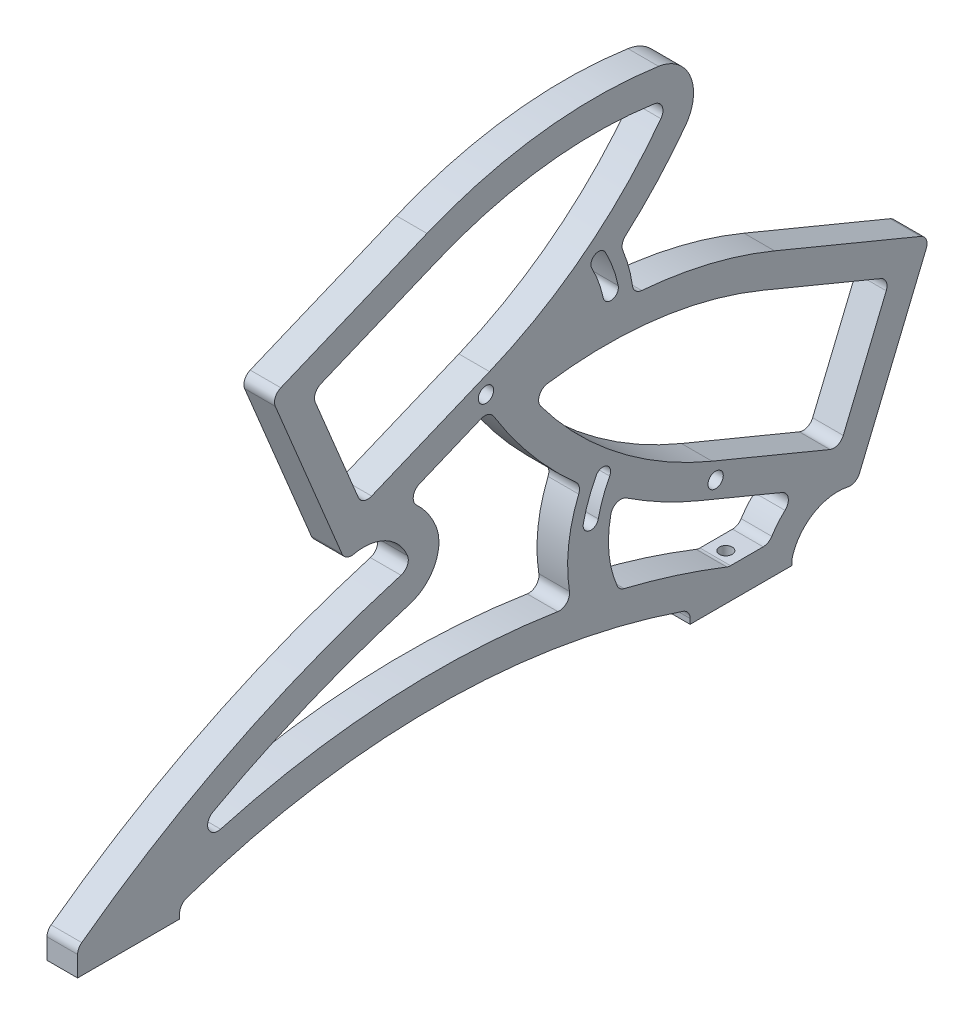
from build123d import *

# Parameters (mm, degrees)
SKETCH1_R                   = 1.5
BOSS_EXTRUDE1_DEPTH         = 6
FILLET1_R                   = 2
TAP_DRILL_FOR_M3_TAP1_D     = 2.5
TAP_DRILL_FOR_M3_TAP1_DEPTH = 10
TAP_DRILL_FOR_M3_TAP1_TIP   = 0.751075774


with BuildPart() as part:
    # Sketch1 → Boss-Extrude1 (new body)
    with BuildSketch(Plane(origin=(0, 0, 0), x_dir=(0, 0, -1), z_dir=(1, 0, 0))):
        with BuildLine():
            Line((0, 0), (0, 5))
            ThreePointArc((0, 5), (30.263904534, 23.654794569), (63.35257649, 36.656527771))
            ThreePointArc((63.35257649, 36.656527771), (64.593543685, 37.712278476), (64.63724154, 39.340989509))
            ThreePointArc((64.63724154, 39.340989509), (59.61305605, 44.365174999), (52.507784789, 44.365174999))
            Line((52.507784789, 44.365174999), (37.965814359, 79.472597235))
            Line((37.965814359, 79.472597235), (68.453838932, 92.101150503))
            ThreePointArc((68.453838932, 92.101150503), (90.758303247, 97.999189725), (113.828291361, 97.771937753))
            ThreePointArc((113.828291361, 97.771937753), (120.071041294, 92.916243967), (119.090244487, 85.068459153))
            ThreePointArc((119.090244487, 85.068459153), (113.049914098, 77.838922298), (106.256946475, 71.311489017))
            ThreePointArc((106.256946475, 71.311489017), (108.007602478, 66.521582509), (108.89212085, 61.499070385))
            ThreePointArc((108.89212085, 61.499070385), (122.984208709, 59.44582567), (136.546161068, 55.101150503))
            Line((136.546161068, 55.101150503), (167.034185641, 42.472597235))
            Line((167.034185641, 42.472597235), (152.492215211, 7.365174999))
            ThreePointArc((152.492215211, 7.365174999), (145.029217261, 7.208101321), (140.094434117, 1.607304426))
            ThreePointArc((140.094434117, 1.607304426), (140.023749539, 1.307301346), (140, 1))
            Line((140, 1), (140, 0))
            Line((140, 0), (120, 0))
            Line((120, 0), (120, 1))
            ThreePointArc((120, 1), (119.627466942, 2.162476387), (118.648648649, 2.891891892))
            ThreePointArc((118.648648649, 2.891891892), (70, 11), (21.351351351, 2.891891892))
            ThreePointArc((21.351351351, 2.891891892), (20.372533058, 2.162476387), (20, 1))
            Line((20, 1), (20, 0))
            Line((20, 0), (0, 0))
        make_face()
        with Locations((80, 59)):
            Circle(SKETCH1_R, mode=Mode.SUBTRACT)
        with Locations((125, 22)):
            Circle(SKETCH1_R, mode=Mode.SUBTRACT)
        with BuildLine():
            Line((63.72452745, 49.011301935), (80.634345003, 56.015577702))
            ThreePointArc((80.634345003, 56.015577702), (88.793282839, 44.416446703), (98.743053525, 34.311489017))
            ThreePointArc((98.743053525, 34.311489017), (96.120508219, 24.64101391), (96.9455023, 14.655263189))
            ThreePointArc((96.9455023, 14.655263189), (53.225179751, 16.095471906), (10.823862094, 5.340516497))
            ThreePointArc((10.823862094, 5.340516497), (36.939787477, 20.226495708), (65.041858534, 30.899243153))
            ThreePointArc((65.041858534, 30.899243153), (70.005727314, 35.122245973), (70.180518735, 41.637090103))
            ThreePointArc((70.180518735, 41.637090103), (67.559666076, 45.855738901), (63.72452745, 49.011301935))
        make_face(mode=Mode.SUBTRACT)
        with BuildLine():
            Line((80.699708768, 62.537005462), (55.75496139, 52.204552788))
            Line((55.75496139, 52.204552788), (45.805192149, 76.225420634))
            Line((45.805192149, 76.225420634), (70.749939526, 86.557873308))
            ThreePointArc((70.749939526, 86.557873308), (91.502380524, 92.045506075), (112.967077451, 91.834066872))
            ThreePointArc((112.967077451, 91.834066872), (114.527764673, 90.620143611), (114.282565525, 88.658197723))
            ThreePointArc((114.282565525, 88.658197723), (99.254242865, 73.330854875), (80.699708768, 62.537005462))
        make_face(mode=Mode.SUBTRACT)
        with BuildLine():
            Line((124.300291232, 25.537005462), (149.24503861, 15.204552788))
            Line((149.24503861, 15.204552788), (159.194807851, 39.225420634))
            Line((159.194807851, 39.225420634), (134.250060474, 49.557873308))
            ThreePointArc((134.250060474, 49.557873308), (113.497619632, 55.045506055), (92.032922859, 54.834066917))
            ThreePointArc((92.032922859, 54.834066917), (90.472235487, 53.620143544), (90.717434663, 51.658197472))
            ThreePointArc((90.717434663, 51.658197472), (105.745757258, 36.330854779), (124.300291232, 25.537005462))
        make_face(mode=Mode.SUBTRACT)
        with BuildLine():
            Line((122.004190638, 19.993728267), (141.27547255, 12.011301935))
            ThreePointArc((141.27547255, 12.011301935), (137.950950961, 9.410732752), (135.464526627, 6))
            Line((135.464526627, 6), (127.541289523, 6))
            ThreePointArc((127.541289523, 6), (116.964502802, 9.762681734), (106.144506127, 12.754982379))
            ThreePointArc((106.144506127, 12.754982379), (104.029107455, 20.894710056), (105.277139326, 29.211710396))
            ThreePointArc((105.277139326, 29.211710396), (113.384661496, 24.138172602), (122.004190638, 19.993728267))
        make_face(mode=Mode.SUBTRACT)
        with BuildLine():
            ThreePointArc((105.920911419, 64.509659807), (104.901854451, 68.063533798), (103.398111211, 71.440996414))
            ThreePointArc((103.398111211, 71.440996414), (101.369482477, 72.061210459), (100.749268432, 70.032581725))
            ThreePointArc((100.749268432, 70.032581725), (102.082776588, 67.037473368), (102.986468617, 63.885924734))
            ThreePointArc((102.986468617, 63.885924734), (104.765557555, 62.730570869), (105.920911419, 64.509659807))
        make_face(mode=Mode.SUBTRACT)
        with BuildLine():
            ThreePointArc((101.601888789, 34.440996414), (100.098145549, 31.063533798), (99.079088581, 27.509659807))
            ThreePointArc((99.079088581, 27.509659807), (100.234442445, 25.730570869), (102.013531383, 26.885924734))
            ThreePointArc((102.013531383, 26.885924734), (102.917223412, 30.037473368), (104.250731568, 33.032581725))
            ThreePointArc((104.250731568, 33.032581725), (103.630517523, 35.061210459), (101.601888789, 34.440996414))
        make_face(mode=Mode.SUBTRACT)
    extrude(amount=BOSS_EXTRUDE1_DEPTH)

    # Fillet1
    fillet1_edges = [part.edges().sort_by_distance(p)[0] for p in [
        (3, 14.655263189, -96.9455023),
        (3, 34.311489017, -98.743053525),
        (3, 12.754982379, -106.144506127),
        (3, 12.011301935, -141.27547255),
        (3, 6, -135.464526627),
        (3, 6, -127.541289523),
        (3, 15.204552788, -149.24503861),
        (3, 39.225420634, -159.194807851),
        (3, 42.472597235, -167.034185641),
        (3, 7.365174999, -152.492215211),
        (3, 52.204552788, -55.75496139),
        (3, 79.472597235, -37.965814359),
        (3, 76.225420634, -45.805192149),
        (3, 44.365174999, -52.507784789),
        (3, 49.011301935, -63.72452745),
        (3, 5.340516497, -10.823862094),
        (3, 5, 0),
        (3, 61.499070385, -108.89212085),
        (3, 71.311489017, -106.256946475),
        (3, 29.211710396, -105.277139326),
        (3, 56.015577702, -80.634345003),
    ]]
    fillet(fillet1_edges, radius=FILLET1_R)

    # Tap Drill for M3 Tap1
    with Locations(Plane(origin=(0, 0, 0), x_dir=(-1, 0, 0), z_dir=(0, -1, 0))):
        with Locations((-3, 10), (-3, 130)):
            Hole(TAP_DRILL_FOR_M3_TAP1_D / 2, depth=TAP_DRILL_FOR_M3_TAP1_DEPTH)
            with Locations((0, 0, -(TAP_DRILL_FOR_M3_TAP1_DEPTH + TAP_DRILL_FOR_M3_TAP1_TIP / 2))):  # 118° drill point
                Cone(0, TAP_DRILL_FOR_M3_TAP1_D / 2, TAP_DRILL_FOR_M3_TAP1_TIP, mode=Mode.SUBTRACT)


solid = part.part
